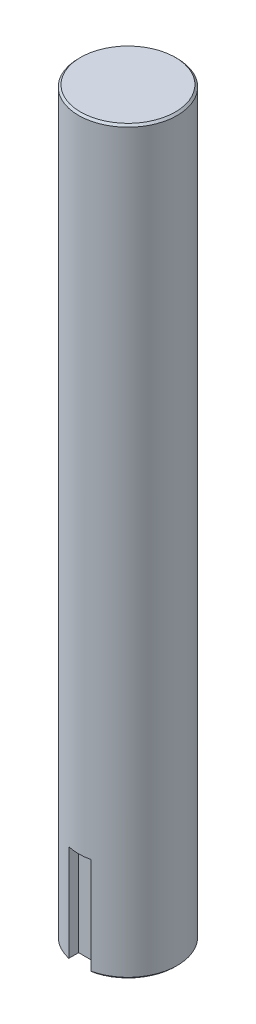
from build123d import *

# Parameters (mm, degrees)
SKETCH1_W          = 5
SKETCH1_H          = 75
SKETCH2_W          = 2.25
SKETCH2_H          = 2.25
CUT_EXTRUDE1_DEPTH = 10
CHAMFER1_SIZE      = 0.2


with BuildPart() as part:
    # Sketch1 → Revolve1 (revolve)
    with BuildSketch(Plane.XY):
        with Locations((2.5, 37.5)):
            Rectangle(SKETCH1_W, SKETCH1_H)
    revolve(axis=Axis((0, 75, 0), (0, -1, 0)))

    # Sketch2 → Cut-Extrude1 (cut)
    with BuildSketch(Plane.XZ):
        with Locations((0, 5)):
            Rectangle(SKETCH2_W, SKETCH2_H)
    extrude(amount=-CUT_EXTRUDE1_DEPTH, mode=Mode.SUBTRACT)

    # Chamfer1
    chamfer1_edges = [part.edges().sort_by_distance(p)[0] for p in [
        (-5, 75, 0),
        (-1.125, 0, 4.373396909),
        (0, 0, 3.875),
        (1.125, 0, 4.373396909),
        (-3.112474899, 0, -3.913118961),
    ]]
    chamfer(chamfer1_edges, length=CHAMFER1_SIZE)


solid = part.part
